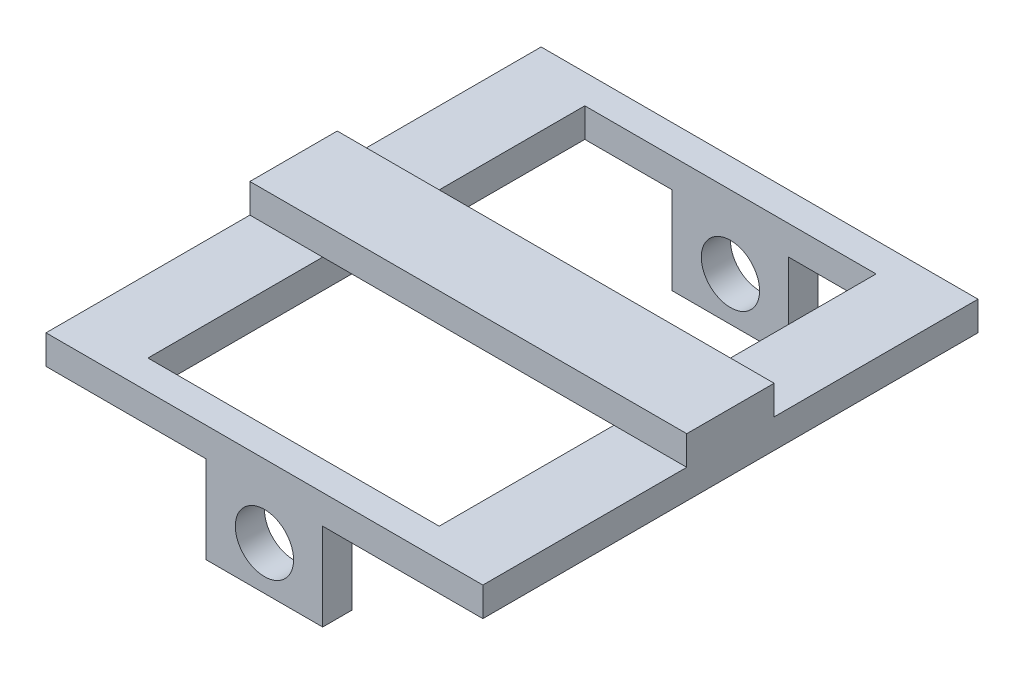
from build123d import *

# Parameters (mm, degrees)
SKETCH1_W           = 150
SKETCH1_H           = 30
BOSS_EXTRUDE1_DEPTH = 10
SKETCH9_W           = 150
SKETCH9_H           = 170
SKETCH9_W_2         = 100
SKETCH9_H_2         = 150
BOSS_EXTRUDE3_DEPTH = 10
BOSS_EXTRUDE5_DEPTH = 30
SKETCH16_R          = 10
CUT_EXTRUDE2_DEPTH  = 170


with BuildPart() as part:
    # Sketch1 → Boss-Extrude1 (new body)
    with BuildSketch(Plane(origin=(0, 0, 0), x_dir=(1, 0, 0), z_dir=(0, 1, 0))):
        with Locations((-75, 15)):
            Rectangle(SKETCH1_W, SKETCH1_H)
    extrude(amount=BOSS_EXTRUDE1_DEPTH)

    # Sketch9 → Boss-Extrude3 (add)
    with BuildSketch(Plane.XZ):
        with Locations((-75, -15)):
            Rectangle(SKETCH9_W, SKETCH9_H)
        with Locations((-75, -15)):
            Rectangle(SKETCH9_W_2, SKETCH9_H_2, mode=Mode.SUBTRACT)
    extrude(amount=BOSS_EXTRUDE3_DEPTH)

    # Sketch12 → Boss-Extrude5 (add)
    with BuildSketch(Plane.XZ.offset(10)):
        Polygon((-55, -100), (-55, -90), (-75, -90), (-95, -90), (-95, -100), (-75, -100), align=None)
        Polygon((-75, 70), (-55, 70), (-55, 60), (-75, 60), (-95, 60), (-95, 70), align=None)
    extrude(amount=BOSS_EXTRUDE5_DEPTH)

    # Sketch16 → Cut-Extrude2 (cut)
    with BuildSketch(Plane.XY.offset(70)):
        with Locations((-75, -25)):
            Circle(SKETCH16_R)
    extrude(amount=-CUT_EXTRUDE2_DEPTH, mode=Mode.SUBTRACT)


solid = part.part
